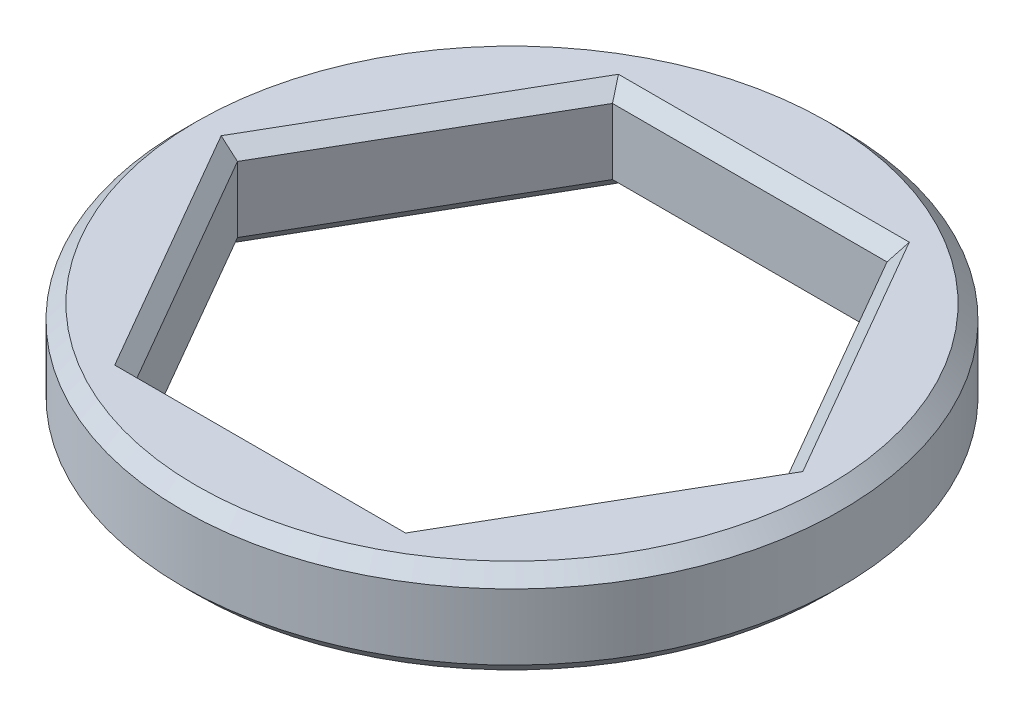
from build123d import *

# Parameters (mm, degrees)
SKETCH1_R           = 8.89
BOSS_EXTRUDE1_DEPTH = 1.27
CHAMFER1_SIZE       = 0.381


with BuildPart() as part:
    # Sketch1 → Boss-Extrude1 (new, symmetric)
    with BuildSketch(Plane(origin=(0, 0, 0), x_dir=(1, 0, 0), z_dir=(0, 1, 0))):
        Circle(SKETCH1_R)
        Polygon((3.702835951, -6.4135), (7.405671903, 0), (3.702835951, 6.4135), (-3.702835951, 6.4135), (-7.405671903, 0), (-3.702835951, -6.4135), align=None, mode=Mode.SUBTRACT)
    extrude(amount=BOSS_EXTRUDE1_DEPTH, both=True)

    # Chamfer1
    chamfer1_edges = [part.edges().sort_by_distance(p)[0] for p in [
        (-8.89, -1.27, 0),
        (-8.89, 1.27, 0),
        (-5.554253927, -1.27, 3.20675),
        (-5.554253927, -1.27, -3.20675),
        (0, -1.27, -6.4135),
        (5.554253927, -1.27, -3.20675),
        (5.554253927, -1.27, 3.20675),
        (0, -1.27, 6.4135),
        (5.554253927, 1.27, -3.20675),
        (0, 1.27, -6.4135),
        (-5.554253927, 1.27, -3.20675),
        (-5.554253927, 1.27, 3.20675),
        (0, 1.27, 6.4135),
        (5.554253927, 1.27, 3.20675),
    ]]
    chamfer(chamfer1_edges, length=CHAMFER1_SIZE)


solid = part.part
